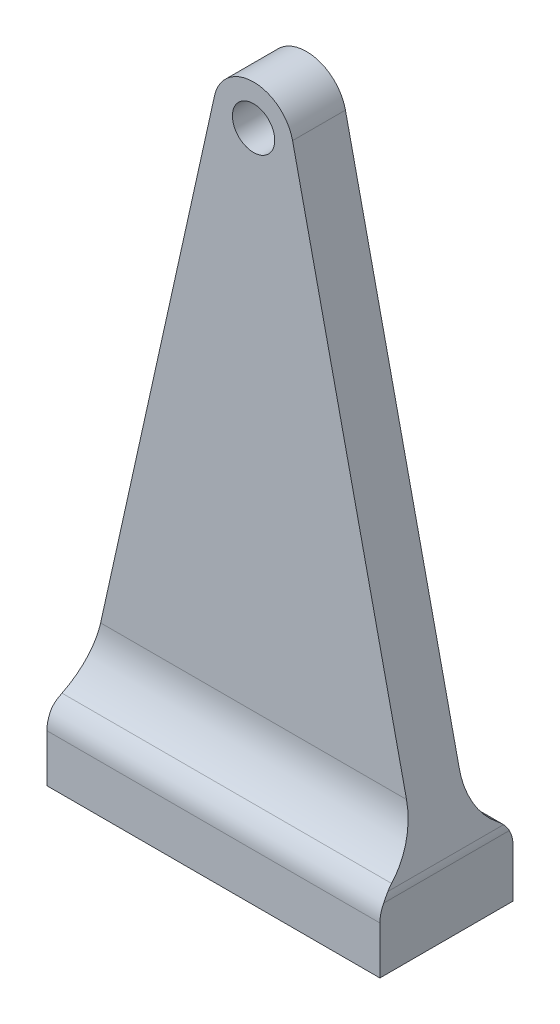
from build123d import *

# Parameters (mm, degrees)
SKETCH1_R               = 3.175
BOSS_EXTRUDE1_DEPTH     = 20
CUT_EXTRUDE1_DEPTH      = 25
CUT_EXTRUDE1_DEPTH_BACK = 25
SKETCH2_W               = 6.03125
SKETCH2_H               = 91
FILLET1_R               = 10
FILLET2_R               = 5
SKETCH3_R               = 2.38125
CUT_EXTRUDE2_DEPTH      = 6.4


with BuildPart() as part:
    # Sketch1 → Boss-Extrude1 (new body)
    with BuildSketch(Plane.XY):
        with BuildLine():
            Line((-5.85762861, 86.299302532), (-25, 0))
            Line((-25, 0), (-25, -10))
            Line((-25, -10), (25, -10))
            Line((25, -10), (25, 0))
            Line((25, 0), (5.85762861, 86.299302532))
            ThreePointArc((5.85762861, 86.299302532), (0, 91), (-5.85762861, 86.299302532))
        make_face()
        with Locations((0, 85)):
            Circle(SKETCH1_R, mode=Mode.SUBTRACT)
    extrude(amount=BOSS_EXTRUDE1_DEPTH)

    # Sketch2 → Cut-Extrude1 (cut, two sides: drawn at the far end of the back side and taken through both)
    with BuildSketch(Plane(origin=(0, 0, 0), x_dir=(0, 0, -1), z_dir=(1, 0, 0)).offset(-CUT_EXTRUDE1_DEPTH_BACK)):
        with Locations((-16.984375, 45.5)):
            Rectangle(SKETCH2_W, SKETCH2_H)
        with Locations((-3.015625, 45.5)):
            Rectangle(SKETCH2_W, SKETCH2_H)
    extrude(amount=CUT_EXTRUDE1_DEPTH + CUT_EXTRUDE1_DEPTH_BACK, mode=Mode.SUBTRACT)

    # Fillet1
    # the kernel refuses this fillet: 10 mm, written as the material it adds along each edge
    with BuildSketch(Plane(origin=(-25, 0, 13.96875), x_dir=(0, 1, 0), z_dir=(1, 0, 0))) as fillet1_piece_1_section:
        with BuildLine():
            CenterArc((9.178726678, 10), FILLET1_R, 203.382964427, 66.617035573)
            Line((0, 6.03125), (-0.183574534, 5.951875))
            ThreePointArc((-0.183574534, 5.951875), (-0.2, 3.015625), (-0.2, 0))
            Line((-0.2, 0), (0, -0.2))
            Line((0, -0.2), (9.178726678, -0.2))
            Line((9.178726678, -0.2), (9.178726678, 0))
        make_face()
    fillet1_piece_1 = extrude(amount=50, mode=Mode.PRIVATE)
    fillet1_piece_1 = split(fillet1_piece_1, bisect_by=Plane(origin=(23.363313282, 7.378653319, 15.543546825), z_dir=(-0.9762714349563381, -0.2165504220459817, 0)), keep=Keep.TOP, mode=Mode.PRIVATE)
    fillet1_piece_1 = split(fillet1_piece_1, bisect_by=Plane(origin=(-23.363313282, 7.378653319, 15.543546825), z_dir=(0.9762714349563381, -0.2165504220459817, 0)), keep=Keep.TOP, mode=Mode.PRIVATE)
    add(fillet1_piece_1)
    with BuildSketch(Plane(origin=(25, 0, 6.03125), x_dir=(0, 1, 0), z_dir=(-1, 0, 0))) as fillet1_piece_2_section:
        with BuildLine():
            CenterArc((9.178726678, 10), FILLET1_R, 203.382964427, 66.617035573)
            Line((0, 6.03125), (-0.183574534, 5.951875))
            ThreePointArc((-0.183574534, 5.951875), (-0.2, 3.015625), (-0.2, 0))
            Line((-0.2, 0), (0, -0.2))
            Line((0, -0.2), (9.178726678, -0.2))
            Line((9.178726678, -0.2), (9.178726678, 0))
        make_face()
    fillet1_piece_2 = extrude(amount=50, mode=Mode.PRIVATE)
    fillet1_piece_2 = split(fillet1_piece_2, bisect_by=Plane(origin=(23.363313282, 7.378653319, 4.456453175), z_dir=(-0.9762714349563381, -0.2165504220459817, 0)), keep=Keep.TOP, mode=Mode.PRIVATE)
    fillet1_piece_2 = split(fillet1_piece_2, bisect_by=Plane(origin=(-23.363313282, 7.378653319, 4.456453175), z_dir=(0.9762714349563381, -0.2165504220459817, 0)), keep=Keep.TOP, mode=Mode.PRIVATE)
    add(fillet1_piece_2)

    # Fillet2
    # the kernel refuses this fillet: 5 mm, written as the material it takes off along each edge
    with BuildSketch(Plane(origin=(-25, 0, -1.369690533), x_dir=(0, -1, 0), z_dir=(0, 0, 1)), Plane(origin=(25, 0, 21.369690533), x_dir=(0, -1, 0), z_dir=(0, 0, -1))) as fillet2_piece_1:
        with BuildLine():
            CenterArc((FILLET2_R * 0.109575242659, FILLET2_R), FILLET2_R, 257.493496935, 12.506503065)
            Line((-FILLET2_R * 0.106975179387, FILLET2_R * 0.0237285650437), (0, 0))
            Line((0, 0), (FILLET2_R * 0.109575242659, 0))
        make_face()
    extrude(amount=22.739381066, mode=Mode.SUBTRACT)
    with BuildSketch(Plane(origin=(32.111618418, 0, 0), x_dir=(0, 0.5007842597579724, 0.8655721374782461), z_dir=(-1, 0, 0))) as fillet2_piece_2:
        with BuildLine():
            CenterArc((2.903306061, -4.966168801), FILLET2_R, 96.668935359, 53.279164854)
            Line((-1.424554626, -2.462247502), (0, 0))
            ThreePointArc((0, 0), (1.161322425, -0.067662399), (2.322644849, 0))
        make_face()
    extrude(amount=64.223236835, mode=Mode.SUBTRACT)
    with BuildSketch(Plane(origin=(32.111618418, 0, 20), x_dir=(0, -1, 0), z_dir=(-1, 0, 0))) as fillet2_piece_3:
        with BuildLine():
            CenterArc((2.844647367, -5), FILLET2_R, 90, 53.279164854)
            ThreePointArc((-1.163143981, -2.010416667), (-0.523005304, -1.039092598), (0, 0))
            Line((0, 0), (2.844647367, 0))
        make_face()
    extrude(amount=64.223236835, mode=Mode.SUBTRACT)

    # Sketch3 → Cut-Extrude2 (cut)
    with BuildSketch(Plane.XZ.offset(10)):
        with Locations(Location((-15.5, 14.5, 0), (0, 0, 270))):
            Circle(SKETCH3_R)
        with Locations(Location((-15.5, 5.5, 0), (0, 0, 270))):
            Circle(SKETCH3_R)
        with Locations(Location((15.5, 14.5, 0), (0, 0, 270))):
            Circle(SKETCH3_R)
        with Locations(Location((15.5, 5.5, 0), (0, 0, 270))):
            Circle(SKETCH3_R)
    extrude(amount=-CUT_EXTRUDE2_DEPTH, mode=Mode.SUBTRACT)


solid = part.part
